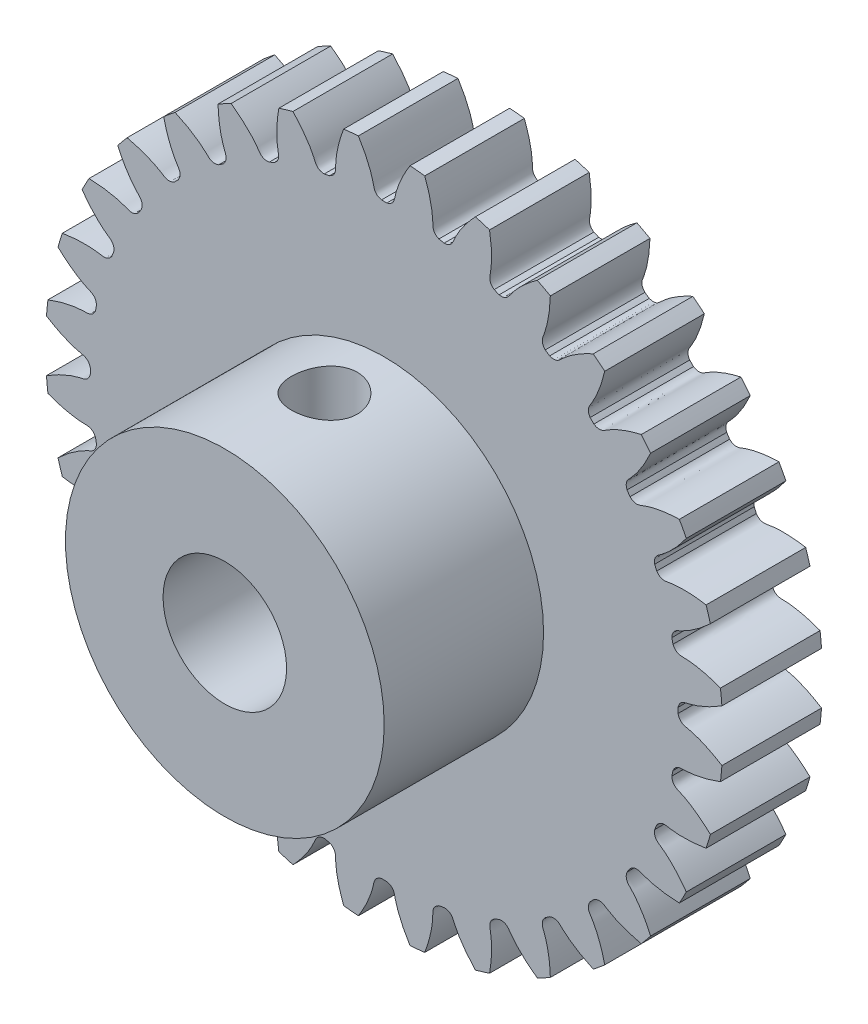
from build123d import *

# Parameters (mm, degrees)
SKETCH_1_R               = 8.5
EXTRUDE_1_DEPTH          = 2.5
CUT_EXTRUDE_1_DEPTH      = 13.278029158
PATTERN_CIRCULAR_1_COUNT = 32
SKETCH_5_R               = 4
EXTRUDE_2_DEPTH          = 4
CUT_EXTRUDE_2_REACH      = 15.635
SKETCH_4_R               = 1.55
CUT_EXTRUDE_3_REACH      = 15.635
SKETCH_6_R               = 0.825


with BuildPart() as part:
    # 草图1 → 凸台-拉伸1 (new body)
    with BuildSketch(Plane.XY):
        Circle(SKETCH_1_R)
    extrude(amount=EXTRUDE_1_DEPTH)

    # 草图2 → 切除-拉伸1 (cut, through all)
    with BuildSketch(Plane.XY):
        with BuildLine():
            ThreePointArc((0.067016057, 7.374695509), (0, 7.375), (-0.067016057, 7.374695509))
            add(Edge.make_bspline(
                [(-0.067016057, 7.374695509), (-0.244409752, 7.417585205), (-0.254185421, 7.546206625), (-0.286714327, 7.680381026), (-0.295183058, 7.71268082), (-0.305128683, 7.747692877), (-0.31664673, 7.785376713), (-0.32985255, 7.825680217), (-0.344853694, 7.868550436), (-0.361758143, 7.913930361), (-0.380671731, 7.961759942), (-0.401698795, 8.011975833), (-0.424941869, 8.064511528), (-0.450501667, 8.119297378), (-0.478476978, 8.176260642), (-0.508964584, 8.235325541), (-0.542059185, 8.296413305), (-0.577853311, 8.359442229), (-0.616437247, 8.424327727), (-0.657898954, 8.490982392), (-0.702323991, 8.559316051), (-0.749795443, 8.629235832), (-0.800393843, 8.700646224), (-0.854197106, 8.773449143), (-0.911280452, 8.847543999), (-0.971716342, 8.922827763), (-1.035574408, 8.999195043), (-1.102921392, 9.07653815), (-1.173821075, 9.154747175), (-1.248334222, 9.233710065), (-1.326518523, 9.313312698), (-1.40842851, 9.393438964), (-1.524138832, 9.502187768), (-1.614498649, 9.582084996), (-1.676516268, 9.63480345)],
                knots=[0, 0, 0, 0, 0.124532679, 0.135328735, 0.147193327, 0.160126453, 0.174128116, 0.189198313, 0.205337046, 0.222544314, 0.240820117, 0.260164456, 0.28057733, 0.302058739, 0.324608684, 0.348227164, 0.372914179, 0.39866973, 0.425493816, 0.453386438, 0.482347595, 0.512377287, 0.543475514, 0.575642277, 0.608877575, 0.643181408, 0.678553777, 0.714994681, 0.752504121, 0.791082096, 0.830728606, 0.871443651, 0.913227232, 1, 1, 1, 1], degree=3))
            ThreePointArc((-1.676516268, 9.63480345), (0, 9.779577922), (1.676516268, 9.63480345))
            add(Edge.make_bspline(
                [(0.067016057, 7.374695509), (0.244409752, 7.417585205), (0.254185421, 7.546206625), (0.286714327, 7.680381026), (0.295183058, 7.71268082), (0.305128683, 7.747692877), (0.31664673, 7.785376713), (0.32985255, 7.825680217), (0.344853694, 7.868550436), (0.361758143, 7.913930361), (0.380671731, 7.961759942), (0.401698795, 8.011975833), (0.424941869, 8.064511528), (0.450501667, 8.119297378), (0.478476978, 8.176260642), (0.508964584, 8.235325541), (0.542059185, 8.296413305), (0.577853311, 8.359442229), (0.616437247, 8.424327727), (0.657898954, 8.490982392), (0.702323991, 8.559316051), (0.749795443, 8.629235832), (0.800393843, 8.700646224), (0.854197106, 8.773449143), (0.911280452, 8.847543999), (0.971716342, 8.922827763), (1.035574408, 8.999195043), (1.102921392, 9.07653815), (1.173821075, 9.154747175), (1.248334222, 9.233710065), (1.326518523, 9.313312698), (1.40842851, 9.393438964), (1.524138832, 9.502187768), (1.614498649, 9.582084996), (1.676516268, 9.63480345)],
                knots=[0, 0, 0, 0, 0.124532679, 0.135328735, 0.147193327, 0.160126453, 0.174128116, 0.189198313, 0.205337046, 0.222544314, 0.240820117, 0.260164456, 0.28057733, 0.302058739, 0.324608684, 0.348227164, 0.372914179, 0.39866973, 0.425493816, 0.453386438, 0.482347595, 0.512377287, 0.543475514, 0.575642277, 0.608877575, 0.643181408, 0.678553777, 0.714994681, 0.752504121, 0.791082096, 0.830728606, 0.871443651, 0.913227232, 1, 1, 1, 1], degree=3))
        make_face()
    cut_extrude_1 = extrude(amount=CUT_EXTRUDE_1_DEPTH, mode=Mode.SUBTRACT)

    # 阵列(圆周)1: 切除-拉伸1 ×32 about axis
    pattern_circular_1_axis = Axis((0, 0, 2.5), (0, 0, -1))
    for i in range(1, PATTERN_CIRCULAR_1_COUNT):
        add(cut_extrude_1.rotate(pattern_circular_1_axis, i * 360 / PATTERN_CIRCULAR_1_COUNT), mode=Mode.SUBTRACT)

    # 草图5 → 凸台-拉伸2 (add)
    with BuildSketch(Plane.XY.offset(2.5)):
        Circle(SKETCH_5_R)
    extrude(amount=EXTRUDE_2_DEPTH)

    # 草图4 → 切除-拉伸2 (cut, up to next)
    with BuildSketch(Plane(origin=(0, 0, 0), x_dir=(-1, 0, 0), z_dir=(0, 0, -1)), mode=Mode.PRIVATE) as cut_extrude_2_sk1:
        Circle(SKETCH_4_R)
    cut_extrude_2_tool1 = extrude(cut_extrude_2_sk1.sketch, amount=-CUT_EXTRUDE_2_REACH, mode=Mode.PRIVATE) & part.part
    add(cut_extrude_2_tool1.solids().sort_by_distance((0, 0, 0))[0], mode=Mode.SUBTRACT)

    # 草图6 → 切除-拉伸3 (cut, up to next)
    with BuildSketch(Plane(origin=(0, 0, 0), x_dir=(1, 0, 0), z_dir=(0, 1, 0)), mode=Mode.PRIVATE) as cut_extrude_3_sk1:
        with Locations((0, -4)):
            Circle(SKETCH_6_R)
    cut_extrude_3_tool1 = extrude(cut_extrude_3_sk1.sketch, amount=CUT_EXTRUDE_3_REACH, mode=Mode.PRIVATE) & part.part
    add(cut_extrude_3_tool1.solids().sort_by_distance((0, 0, 4))[0], mode=Mode.SUBTRACT)


solid = part.part
